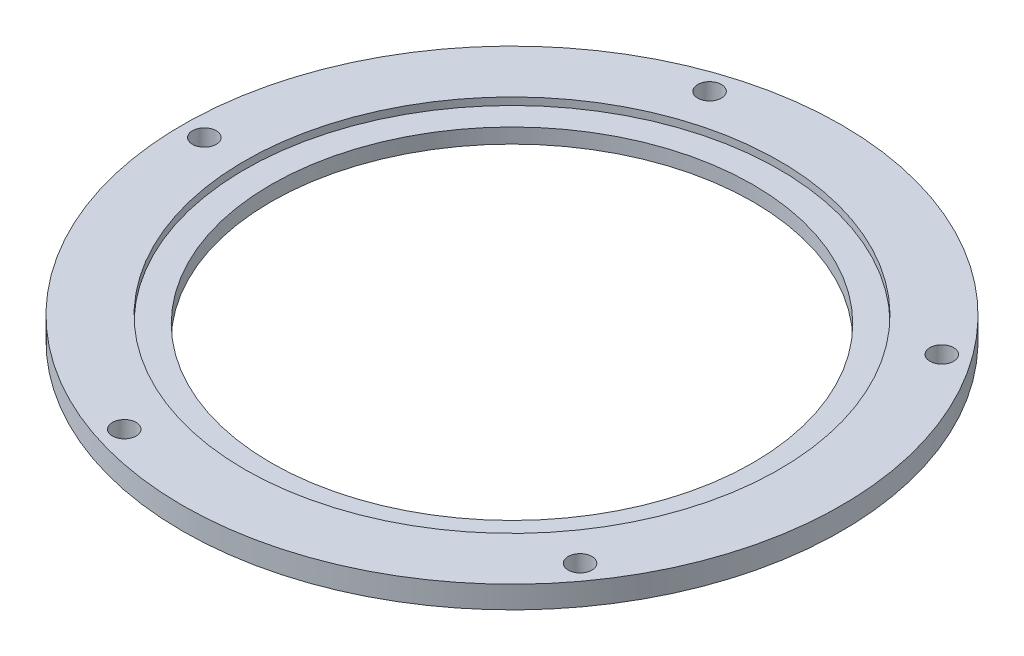
from build123d import *

# Parameters (mm, degrees)
SKETCH1_R            = 44.45
SKETCH1_R_2          = 36.05
BOSS_EXTRUDE1_DEPTH  = 3
SKETCH1_3_R          = 36.05
SKETCH1_3_R_2        = 32.5
BOSS_EXTRUDE2_DEPTH  = 2
M3_CLEARANCE_HOLE1_D = 3.2
CIRPATTERN1_COUNT    = 5


with BuildPart() as part:
    # Sketch1 → Boss-Extrude1 (new body)
    with BuildSketch(Plane(origin=(0, 0, 0), x_dir=(1, 0, 0), z_dir=(0, 1, 0))):
        Circle(SKETCH1_R)
        Circle(SKETCH1_R_2, mode=Mode.SUBTRACT)
    extrude(amount=BOSS_EXTRUDE1_DEPTH)

    # Sketch1<3> → Boss-Extrude2 (add)
    with BuildSketch(Plane(origin=(0, 0, 0), x_dir=(1, 0, 0), z_dir=(0, 1, 0))):
        Circle(SKETCH1_3_R)
        Circle(SKETCH1_3_R_2, mode=Mode.SUBTRACT)
    extrude(amount=BOSS_EXTRUDE2_DEPTH)

    # M3 Clearance Hole1 (through all)
    with Locations(Plane(origin=(0, 3, 0), x_dir=(1, 0, 0), z_dir=(0, 1, 0))):
        with Locations((-41.5, 0)):
            m3_clearance_hole1 = Hole(M3_CLEARANCE_HOLE1_D / 2)

    # CirPattern1: M3 Clearance Hole1 ×5 about axis
    cirpattern1_axis = Axis((0, 3, 0), (0, -1, 0))
    for i in range(1, CIRPATTERN1_COUNT):
        add(m3_clearance_hole1.rotate(cirpattern1_axis, i * 360 / CIRPATTERN1_COUNT), mode=Mode.SUBTRACT)


solid = part.part
